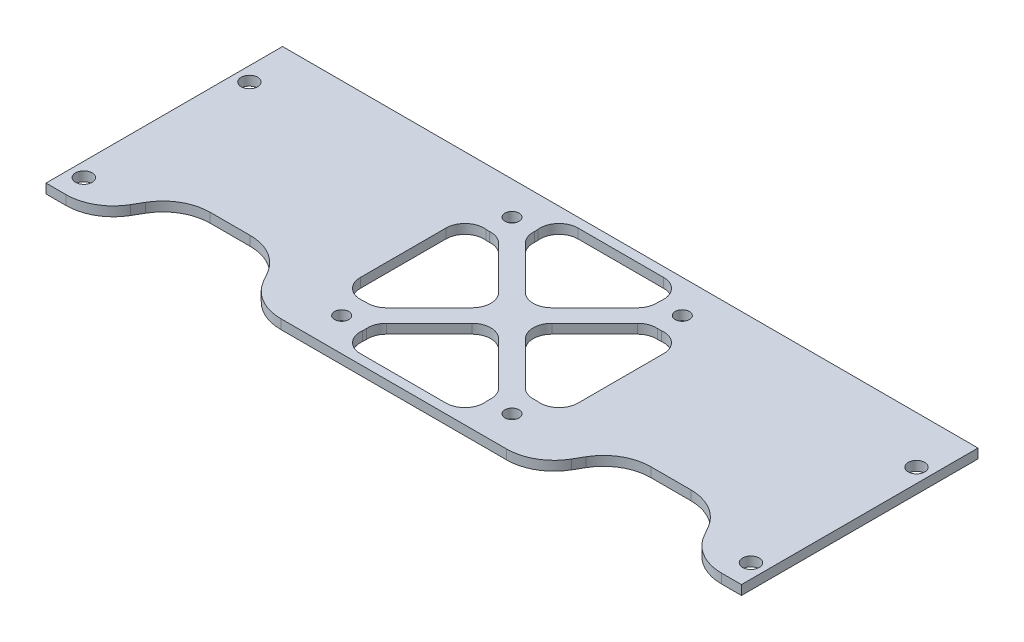
from build123d import *

# Parameters (mm, degrees)
SKETCH_1_W          = 147
SKETCH_1_H          = 50
SKETCH_1_R          = 1.5
EXTRUDE_1_DEPTH     = 2
CUT_EXTRUDE_1_DEPTH = 2
FILLET_2_DEPTH      = 2
FILLET_3_R          = 4
CUT_EXTRUDE_3_DEPTH = 78.661122835
SKETCH_7_R          = 1.75
CUT_EXTRUDE_4_DEPTH = 78.661122835
FILLET_4_R          = 10


with BuildPart() as part:
    # 草图1 → 凸台-拉伸1 (new body)
    with BuildSketch(Plane(origin=(0, 0, 0), x_dir=(1, 0, 0), z_dir=(0, 1, 0))):
        Rectangle(SKETCH_1_W, SKETCH_1_H)
        with Locations(Location((18, -18, 0), (0, 0, 270))):
            Circle(SKETCH_1_R, mode=Mode.SUBTRACT)
        with Locations(Location((-18, -18, 0), (0, 0, 270))):
            Circle(SKETCH_1_R, mode=Mode.SUBTRACT)
        with Locations(Location((-18, 18, 0), (0, 0, 270))):
            Circle(SKETCH_1_R, mode=Mode.SUBTRACT)
        with Locations(Location((18, 18, 0), (0, 0, 270))):
            Circle(SKETCH_1_R, mode=Mode.SUBTRACT)
    extrude(amount=EXTRUDE_1_DEPTH)

    # 草图3 → 切除-拉伸1 (cut)
    with BuildSketch(Plane(origin=(0, 2, 0), x_dir=(1, 0, 0), z_dir=(0, 1, 0))):
        with BuildLine():
            Line((-13.345416088, 16.173843213), (0, 2.828427125))
            Line((0, 2.828427125), (13.345416088, 16.173843213))
            ThreePointArc((13.345416088, 16.173843213), (13.868972045, 20.816843629), (18, 23))
            Line((18, 23), (-18, 23))
            ThreePointArc((-18, 23), (-14.464466094, 21.535533906), (-13, 18))
            ThreePointArc((-13, 18), (-13.087112888, 17.070731352), (-13.345416088, 16.173843213))
        make_face()
        with BuildLine():
            Line((16.173843213, 13.345416088), (2.828427125, 0))
            Line((2.828427125, 0), (16.173843213, -13.345416088))
            ThreePointArc((16.173843213, -13.345416088), (20.816843629, -13.868972045), (23, -18))
            Line((23, -18), (23, 18))
            ThreePointArc((23, 18), (20.816843629, 13.868972045), (16.173843213, 13.345416088))
        make_face()
        with BuildLine():
            Line((0, -2.828427125), (-13.345416088, -16.173843213))
            ThreePointArc((-13.345416088, -16.173843213), (-13.087112888, -17.070731352), (-13, -18))
            ThreePointArc((-13, -18), (-14.464466094, -21.535533906), (-18, -23))
            Line((-18, -23), (18, -23))
            ThreePointArc((18, -23), (13.868972045, -20.816843629), (13.345416088, -16.173843213))
            Line((13.345416088, -16.173843213), (0, -2.828427125))
        make_face()
        with BuildLine():
            ThreePointArc((-23, -18), (-20.816843629, -13.868972045), (-16.173843213, -13.345416088))
            Line((-16.173843213, -13.345416088), (-2.828427125, 0))
            Line((-2.828427125, 0), (-16.173843213, 13.345416088))
            ThreePointArc((-16.173843213, 13.345416088), (-20.816843629, 13.868972045), (-23, 18))
            Line((-23, 18), (-23, -18))
        make_face()
    extrude(amount=-CUT_EXTRUDE_1_DEPTH, mode=Mode.SUBTRACT)

    # 圆角2: read off the stored shape, not the designer's step
    # 圆角2 outline → 圆角2 (add)
    with BuildSketch(Plane(origin=(0, 0, 0), x_dir=(1, 0, 0), z_dir=(0, 1, 0))):
        with BuildLine():
            Line((-23, 18), (-23, 9.05572809))
            ThreePointArc((-23, 9.05572809), (-21.666666667, 12.03715206), (-18.555555556, 13.03096005))
            ThreePointArc((-18.555555556, 13.03096005), (-21.726779962, 14.666666667), (-23, 18))
        make_face()
        with BuildLine():
            ThreePointArc((-18.555555556, -13.03096005), (-21.666666667, -12.03715206), (-23, -9.05572809))
            Line((-23, -9.05572809), (-23, -18))
            ThreePointArc((-23, -18), (-21.726779962, -14.666666667), (-18.555555556, -13.03096005))
        make_face()
        with BuildLine():
            ThreePointArc((13.03096005, -18.555555556), (12.03715206, -21.666666667), (9.05572809, -23))
            Line((9.05572809, -23), (18, -23))
            ThreePointArc((18, -23), (14.666666667, -21.726779962), (13.03096005, -18.555555556))
        make_face()
        with BuildLine():
            ThreePointArc((-9.05572809, -23), (-12.03715206, -21.666666667), (-13.03096005, -18.555555556))
            ThreePointArc((-13.03096005, -18.555555556), (-14.666666667, -21.726779962), (-18, -23))
            Line((-18, -23), (-9.05572809, -23))
        make_face()
        with BuildLine():
            ThreePointArc((18.555555556, 13.03096005), (21.666666667, 12.03715206), (23, 9.05572809))
            Line((23, 9.05572809), (23, 18))
            ThreePointArc((23, 18), (21.726779962, 14.666666667), (18.555555556, 13.03096005))
        make_face()
        with BuildLine():
            ThreePointArc((23, -9.05572809), (21.666666667, -12.03715206), (18.555555556, -13.03096005))
            ThreePointArc((18.555555556, -13.03096005), (21.726779962, -14.666666667), (23, -18))
            Line((23, -18), (23, -9.05572809))
        make_face()
        with BuildLine():
            ThreePointArc((-13.03096005, 18.555555556), (-12.03715206, 21.666666667), (-9.05572809, 23))
            Line((-9.05572809, 23), (-18, 23))
            ThreePointArc((-18, 23), (-14.666666667, 21.726779962), (-13.03096005, 18.555555556))
        make_face()
        with BuildLine():
            ThreePointArc((9.05572809, 23), (12.03715206, 21.666666667), (13.03096005, 18.555555556))
            ThreePointArc((13.03096005, 18.555555556), (14.666666667, 21.726779962), (18, 23))
            Line((18, 23), (9.05572809, 23))
        make_face()
    extrude(amount=FILLET_2_DEPTH)

    # 圆角3
    fillet_3_edges = [part.edges().sort_by_distance(p)[0] for p in [
        (13.345416088, 1, 16.173843213),
        (-13.345416088, 1, 16.173843213),
        (0, 1, 2.828427125),
        (16.173843213, 1, -13.345416088),
        (16.173843213, 1, 13.345416088),
        (2.828427125, 1, 0),
        (-16.173843213, 1, -13.345416088),
        (-2.828427125, 1, 0),
        (-16.173843213, 1, 13.345416088),
        (-13.345416088, 1, -16.173843213),
        (13.345416088, 1, -16.173843213),
        (0, 1, -2.828427125),
    ]]
    fillet(fillet_3_edges, radius=FILLET_3_R)

    # 草图6 → 切除-拉伸3 (cut, through all)
    with BuildSketch(Plane(origin=(0, 2, 0), x_dir=(1, 0, 0), z_dir=(0, 1, 0))):
        Polygon((63.5, -25), (56.57179677, -13), (36.57179677, -13), (29.643593539, -25), align=None)
    cut_extrude_3 = extrude(amount=-CUT_EXTRUDE_3_DEPTH, mode=Mode.SUBTRACT)

    # 镜向1: 切除-拉伸3 across plane
    add(cut_extrude_3.mirror(Plane(origin=(0, 0, 0), x_dir=(0, 0, 1), z_dir=(1, 0, 0))), mode=Mode.SUBTRACT)

    # 草图7 → 切除-拉伸4 (cut, through all)
    with BuildSketch(Plane.XZ):
        with Locations(Location((70.5, 20, 0), (0, 0, 270))):
            Circle(SKETCH_7_R)
        with Locations(Location((70.5, -15, 0), (0, 0, 270))):
            Circle(SKETCH_7_R)
        with Locations(Location((-70.5, -15, 0), (0, 0, 270))):
            Circle(SKETCH_7_R)
        with Locations(Location((-70.5, 20, 0), (0, 0, 270))):
            Circle(SKETCH_7_R)
    extrude(amount=-CUT_EXTRUDE_4_DEPTH, mode=Mode.SUBTRACT)

    # 圆角4
    fillet_4_edges = [part.edges().sort_by_distance(p)[0] for p in [
        (63.5, 1, 25),
        (29.643593539, 1, 25),
        (36.57179677, 1, 13),
        (56.57179677, 1, 13),
        (-29.643593539, 1, 25),
        (-63.5, 1, 25),
        (-56.57179677, 1, 13),
        (-36.57179677, 1, 13),
    ]]
    fillet(fillet_4_edges, radius=FILLET_4_R)


solid = part.part
